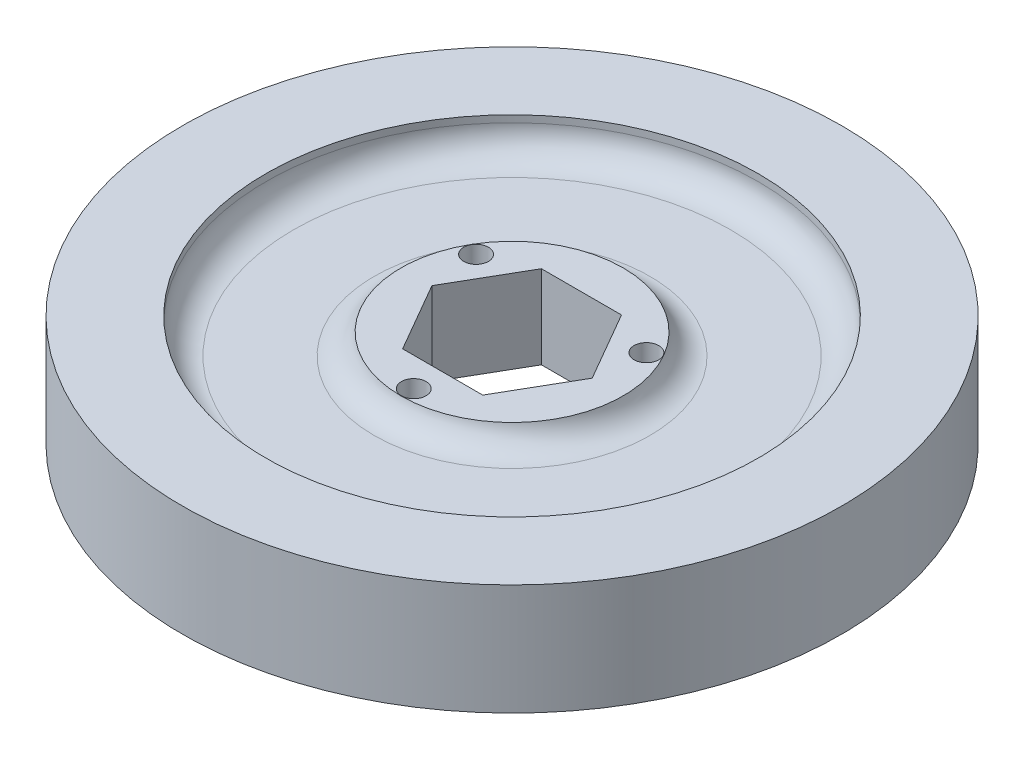
from build123d import *

# Parameters (mm, degrees)
FILLET1_R             = 2.54
FILLET2_R             = 2.54
CUT_EXTRUDE1_DEPTH    = 44.572754245
F_4_40_TAPPED_HOLE1_D = 2.2606


with BuildPart() as part:
    # Sketch1 → Revolve1 (revolve)
    with BuildSketch(Plane.XY, mode=Mode.PRIVATE) as revolve1_sk:
        Polygon((10.16, -1.905), (10.16, -3.81), (0, -3.81), (0, 3.81), (10.16, 3.81), (10.16, 1.905), (22.5425, 1.905), (22.5425, 5.08), (30.1625, 5.08), (30.1625, -5.08), (22.5425, -5.08), (22.5425, -1.905), align=None)
    revolve(revolve1_sk.sketch.rotate(Axis((0, 0, 0), (0, 1, 0)), 90), axis=Axis((0, 0, 0), (0, 1, 0)))

    # Fillet1
    # the kernel refuses this fillet: 2.54 mm, written as the material it adds along each edge
    with BuildSketch(Plane(origin=(0, 1.905, 0), x_dir=(0, 0, -1), z_dir=(1, 0, 0))) as fillet1_piece_1:
        with BuildLine():
            CenterArc((12.619344425, 2.54), FILLET1_R, 194.477512186, 75.522487814)
            Line((12.619344425, 0), (12.619344425, -0.0508))
            Line((12.619344425, -0.0508), (10.16, -0.0508))
            Line((10.16, -0.0508), (10.1092, 0))
            ThreePointArc((10.1092, 0), (10.1092, 0.9525), (10.110813112, 1.8923))
            Line((10.110813112, 1.8923), (10.16, 1.905))
        make_face()
    revolve(axis=Axis((0, 1.905, 0), (0, 1, 0)))
    with BuildSketch(Plane(origin=(0, 1.905, 0), x_dir=(0, 0, -1), z_dir=(1, 0, 0))) as fillet1_piece_2:
        with BuildLine():
            CenterArc((22.5425 - FILLET1_R, FILLET1_R), FILLET1_R, 270, 90)
            Line((22.5425, FILLET1_R), (22.5425 + FILLET1_R * 0.02, FILLET1_R))
            Line((22.5425 + FILLET1_R * 0.02, FILLET1_R), (22.5425 + FILLET1_R * 0.02, -FILLET1_R * 0.02))
            Line((22.5425 + FILLET1_R * 0.02, -FILLET1_R * 0.02), (22.5425 - FILLET1_R, -FILLET1_R * 0.02))
            Line((22.5425 - FILLET1_R, -FILLET1_R * 0.02), (22.5425 - FILLET1_R, 0))
        make_face()
    revolve(axis=Axis((0, 1.905, 0), (0, 1, 0)))

    # Fillet2
    # the kernel refuses this fillet: 2.54 mm, written as the material it adds along each edge
    with BuildSketch(Plane(origin=(0, -1.905, 0), x_dir=(0, 0, -1), z_dir=(1, 0, 0))) as fillet2_piece_1:
        with BuildLine():
            CenterArc((22.5425 - FILLET2_R, -FILLET2_R), FILLET2_R, 0, 90)
            Line((22.5425 - FILLET2_R, 0), (22.5425 - FILLET2_R, FILLET2_R * 0.02))
            Line((22.5425 - FILLET2_R, FILLET2_R * 0.02), (22.5425 + FILLET2_R * 0.02, FILLET2_R * 0.02))
            Line((22.5425 + FILLET2_R * 0.02, FILLET2_R * 0.02), (22.5425 + FILLET2_R * 0.02, -FILLET2_R))
            Line((22.5425 + FILLET2_R * 0.02, -FILLET2_R), (22.5425, -FILLET2_R))
        make_face()
    revolve(axis=Axis((0, -1.905, 0), (0, 1, 0)))
    with BuildSketch(Plane(origin=(0, -1.905, 0), x_dir=(0, 0, -1), z_dir=(1, 0, 0))) as fillet2_piece_2:
        with BuildLine():
            CenterArc((12.619344425, -2.54), FILLET2_R, 90, 75.522487814)
            Line((10.16, -1.905), (10.110813112, -1.8923))
            ThreePointArc((10.110813112, -1.8923), (10.1092, -0.9525), (10.1092, 0))
            Line((10.1092, 0), (10.16, 0.0508))
            Line((10.16, 0.0508), (12.619344425, 0.0508))
            Line((12.619344425, 0.0508), (12.619344425, 0))
        make_face()
    revolve(axis=Axis((0, -1.905, 0), (0, 1, 0)))

    # Sketch2 → Cut-Extrude1 (cut, through all)
    with BuildSketch(Plane.XZ.offset(3.81)):
        Polygon((3.666174209, 6.35), (-3.666174209, 6.35), (-7.332348419, 0), (-3.666174209, -6.35), (3.666174209, -6.35), (7.332348419, 0), align=None)
    extrude(amount=-CUT_EXTRUDE1_DEPTH, mode=Mode.SUBTRACT)

    # #4-40 Tapped Hole1 (through all)
    with Locations(Plane(origin=(0, 3.81, 0), x_dir=(1, 0, 0), z_dir=(0, 1, 0))):
        with Locations((0, -9), (-7.794228634, 4.5), (7.794228634, 4.5)):
            Hole(F_4_40_TAPPED_HOLE1_D / 2)


solid = part.part
